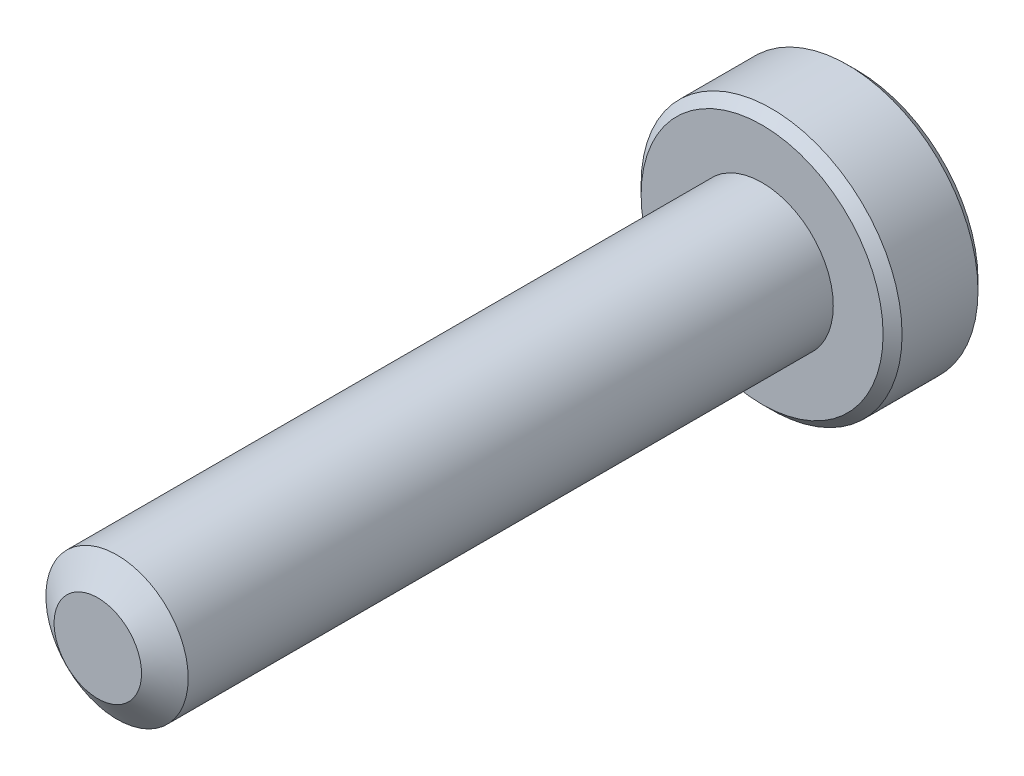
from build123d import *

# Parameters (mm, degrees)
SKETCH1_R          = 1.5
EXTRUDE1_DEPTH     = 14
SKETCH6_R          = 2.75
EXTRUDE2_DEPTH     = 2
CUT_EXTRUDE1_DEPTH = 1.5
CHAMFER1_SIZE      = 0.2


with BuildPart() as part:
    # Sketch1 → Extrude1 (new body)
    with BuildSketch(Plane.XY):
        Circle(SKETCH1_R)
    extrude(amount=-EXTRUDE1_DEPTH)

    # Sketch4 → Cut-Revolve1 (revolve, cut)
    with BuildSketch(Plane(origin=(0, 0, 0), x_dir=(0, 0, -1), z_dir=(1, 0, 0))):
        Polygon((0.405251783, 1.5), (0, 0.921240474), (0, 1.5), align=None)
    revolve(axis=Axis((0, 0, 0), (0, 0, -1)), mode=Mode.SUBTRACT)

    # Sketch6 → Extrude2 (add)
    with BuildSketch(Plane(origin=(0, 0, -14), x_dir=(-1, 0, 0), z_dir=(0, 0, -1))):
        Circle(SKETCH6_R)
    extrude(amount=EXTRUDE2_DEPTH)

    # Sketch7 → Cut-Extrude1 (cut)
    with BuildSketch(Plane(origin=(0, 0, -16), x_dir=(-1, 0, 0), z_dir=(0, 0, -1))):
        Polygon((0, 1.154700538), (-1, 0.577350269), (-1, -0.577350269), (0, -1.154700538), (1, -0.577350269), (1, 0.577350269), align=None)
    extrude(amount=-CUT_EXTRUDE1_DEPTH, mode=Mode.SUBTRACT)

    # Cut-Extrude2 cone 1 section (through the dimple's axis) → Cut-Extrude2 (revolve, cut)
    with BuildSketch(Plane(origin=(0, 0, -16), x_dir=(0, 1, 0), z_dir=(1, 0, 0))):
        Polygon((0, 0), (1.154700538, 0), (0, 1.154700538), align=None)
    revolve(axis=Axis((0, 0, -16), (0, 0, 1)), mode=Mode.SUBTRACT)

    # Chamfer1
    chamfer1_edges = [part.edges().sort_by_distance(p)[0] for p in [
        (2.75, 0, -16),
        (2.75, 0, -14),
    ]]
    chamfer(chamfer1_edges, length=CHAMFER1_SIZE)


solid = part.part
